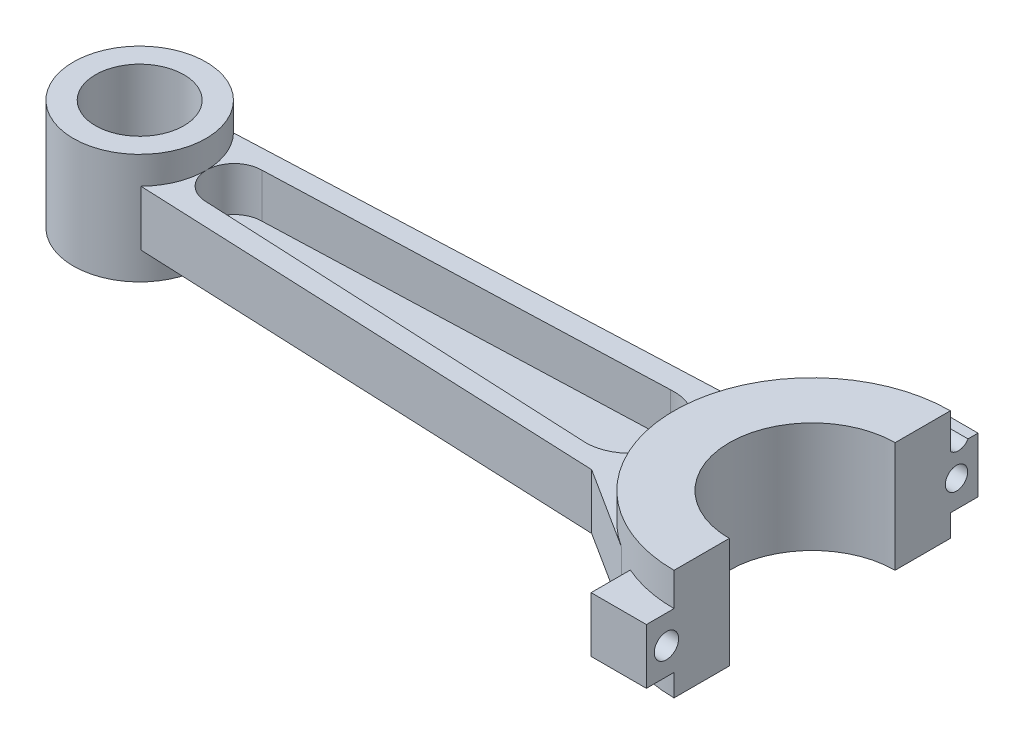
from build123d import *
from build123d.topology import SkipClean

# Parameters (mm, degrees)
EXTRUDE_START       = 5
EXTRUDE_2_DEPTH     = 10
EXTRUDE_4_DEPTH     = 2
EXTRUDE_START_2     = -11
EXTRUDE_5_DEPTH     = 10
EXTRUDE_6_DEPTH     = 20
SKETCH_1_10_R       = 12
EXTRUDE_7_DEPTH     = 10
SKETCH_1_11_R       = 12
EXTRUDE_8_DEPTH     = 20
SKETCH_1_12_R       = 8
CUT_EXTRUDE_1_DEPTH = 20
SKETCH_5_R          = 2
CUT_EXTRUDE_2_DEPTH = 20
EXTRUDE_9_DEPTH     = 20
SKETCH_6_R          = 2.01846984
SKETCH_6_R_2        = 2.203549483
CUT_EXTRUDE_3_DEPTH = 20


with BuildPart() as part:
    # 스케치1 → 보스-돌출2 (new body)
    with BuildSketch(Plane(origin=(0, 0, 0), x_dir=(1, 0, 0), z_dir=(0, 1, 0)).offset(EXTRUDE_START)):
        with BuildLine():
            Line((49.549845173, -12.099230676), (64.355035733, -21.515007377))
            ThreePointArc((64.355035733, -21.515007377), (70.784736297, -24.42375035), (77.771133503, -25.41978705))
            Line((77.771133503, -25.41978705), (77.771133503, -15.41978705))
            ThreePointArc((77.771133503, -15.41978705), (62.771133503, -0.41978705), (77.771133503, 14.58021295))
            Line((77.771133503, 14.58021295), (77.771133503, 24.58021295))
            ThreePointArc((77.771133503, 24.58021295), (71.05915641, 23.662350801), (64.840032894, 20.97616203))
            Line((64.840032894, 20.97616203), (49.823782841, 11.900769324))
            Line((49.823782841, 11.900769324), (-44.228051971, 7.900769324))
            ThreePointArc((-44.228051971, 7.900769324), (-36.228051971, -0.099230676), (-44.228051971, -8.099230676))
            Line((-44.228051971, -8.099230676), (49.549845173, -12.099230676))
        make_face()
        with BuildLine():
            ThreePointArc((44.198484097, 7.559691169), (52.770591505, -0.512908915), (44.012885893, -8.383772269))
            Line((44.012885893, -8.383772269), (-27.228341583, -5))
            ThreePointArc((-27.228341583, -5), (-32.228341583, 0), (-27.228341583, 5))
            Line((-27.228341583, 5), (44.198484097, 7.559691169))
        make_face(mode=Mode.SUBTRACT)
    extrude(amount=EXTRUDE_2_DEPTH)

    # 스케치1<8> → 보스-돌출4 (add)
    with BuildSketch(Plane(origin=(0, 0, 0), x_dir=(1, 0, 0), z_dir=(0, 1, 0)).offset(EXTRUDE_START)):
        with BuildLine():
            Line((44.198484097, 7.559691169), (-27.228341583, 5))
            ThreePointArc((-27.228341583, 5), (-30.774179158, 3.525200121), (-32.228256402, -0.029185644))
            ThreePointArc((-32.228256402, -0.029185644), (-30.753541703, -3.545837575), (-27.228341583, -5))
            Line((-27.228341583, -5), (44.012885893, -8.383772269))
            Line((44.012885893, -8.383772269), (44.771133503, -8.41978705))
            ThreePointArc((44.771133503, -8.41978705), (50.42798774, -6.076641312), (52.771133503, -0.419787086))
            ThreePointArc((52.771133503, -0.419787086), (50.427987765, 5.237067187), (44.771133503, 7.58021295))
            Line((44.771133503, 7.58021295), (44.198484097, 7.559691169))
        make_face()
    extrude(amount=EXTRUDE_4_DEPTH)

    # 스케치2 → 보스-돌출5 (add)
    with BuildSketch(Plane(origin=(0, 15, 0), x_dir=(1, 0, 0), z_dir=(0, 1, 0)).offset(EXTRUDE_START_2)):
        with BuildLine():
            Line((67.771133503, -30.41978705), (77.771133503, -30.41978705))
            Line((77.771133503, -30.41978705), (77.771133503, -25.41978705))
            ThreePointArc((77.771133503, -25.41978705), (72.663392411, -24.892444873), (67.771133503, -23.332665525))
            Line((67.771133503, -23.332665525), (67.771133503, -30.41978705))
        make_face()
        with BuildLine():
            Line((67.771133503, 29.58021295), (67.771133503, 22.493091425))
            ThreePointArc((67.771133503, 22.493091425), (72.663392411, 24.052870773), (77.771133503, 24.58021295))
            Line((77.771133503, 24.58021295), (77.771133503, 29.58021295))
            Line((77.771133503, 29.58021295), (67.771133503, 29.58021295))
        make_face()
    extrude(amount=EXTRUDE_5_DEPTH)

    # 스케치1<9> → 보스-돌출6 (add)
    with BuildSketch(Plane(origin=(0, 0, 0), x_dir=(1, 0, 0), z_dir=(0, 1, 0))):
        with BuildLine():
            Line((-44.228051971, 7.900769324), (-35.625030381, 8.266653588))
            ThreePointArc((-35.625030381, 8.266653588), (-56.22805195, -0.098514915), (-35.626028438, -8.466141165))
            Line((-35.626028438, -8.466141165), (-44.228051971, -8.099230676))
            ThreePointArc((-44.228051971, -8.099230676), (-52.228051971, -0.099230676), (-44.228051971, 7.900769324))
        make_face()
    extrude(amount=EXTRUDE_6_DEPTH)

    # 스케치1<10> → 보스-돌출7 (add)
    with BuildSketch(Plane(origin=(0, 0, 0), x_dir=(1, 0, 0), z_dir=(0, 1, 0))):
        with Locations(Location((-44.228051971, -0.099230676, 0), (0, 0, 44.199354179))):
            Circle(SKETCH_1_10_R)
    extrude(amount=EXTRUDE_7_DEPTH)

    # 스케치1<11> → 보스-돌출8 (add)
    with SkipClean():  # the faces are left unmerged after this step: merging them gives an invalid solid
        with BuildSketch(Plane(origin=(0, 0, 0), x_dir=(1, 0, 0), z_dir=(0, 1, 0))):
            with Locations(Location((-44.228051971, -0.099230676, 0), (0, 0, 270))):
                Circle(SKETCH_1_11_R)
        extrude(amount=EXTRUDE_8_DEPTH)
    add(part.part.scale(1), mode=Mode.REPLACE)  # the faces are merged on a copy

    # 스케치1<12> → 컷-돌출1 (cut)
    with BuildSketch(Plane(origin=(0, 0, 0), x_dir=(1, 0, 0), z_dir=(0, 1, 0))):
        with Locations(Location((-44.228051971, -0.099230676, 0), (0, 0, 90))):
            Circle(SKETCH_1_12_R)
    extrude(amount=CUT_EXTRUDE_1_DEPTH, mode=Mode.SUBTRACT)

    # 스케치5 → 컷-돌출2 (cut)
    with BuildSketch(Plane.ZY.offset(-67.771133503)):
        with Locations((-26.036652187, 15)):
            Circle(SKETCH_5_R)
    extrude(amount=-CUT_EXTRUDE_2_DEPTH, mode=Mode.SUBTRACT)

    # 스케치1<13> → 보스-돌출9 (add)
    with SkipClean():  # the faces are left unmerged after this step: merging them gives an invalid solid
        with BuildSketch(Plane(origin=(0, 0, 0), x_dir=(1, 0, 0), z_dir=(0, 1, 0))):
            with BuildLine():
                Line((77.771133503, 24.58021295), (77.771133503, 14.58021295))
                ThreePointArc((77.771133503, 14.58021295), (62.771133503, -0.41978705), (77.771133503, -15.41978705))
                Line((77.771133503, -15.41978705), (77.771133503, -25.41978705))
                ThreePointArc((77.771133503, -25.41978705), (52.771133503, -0.41978705), (77.771133503, 24.58021295))
            make_face()
        extrude(amount=EXTRUDE_9_DEPTH)
    add(part.part.scale(1), mode=Mode.REPLACE)  # the faces are merged on a copy

    # 스케치6 → 컷-돌출3 (cut)
    with BuildSketch(Plane.ZY.offset(-67.771133503)):
        with Locations((-25.686179168, 8.874314897)):
            Circle(SKETCH_6_R)
        with Locations((26.79403668, 8.874314897)):
            Circle(SKETCH_6_R_2)
    extrude(amount=-CUT_EXTRUDE_3_DEPTH, mode=Mode.SUBTRACT)


solid = part.part
